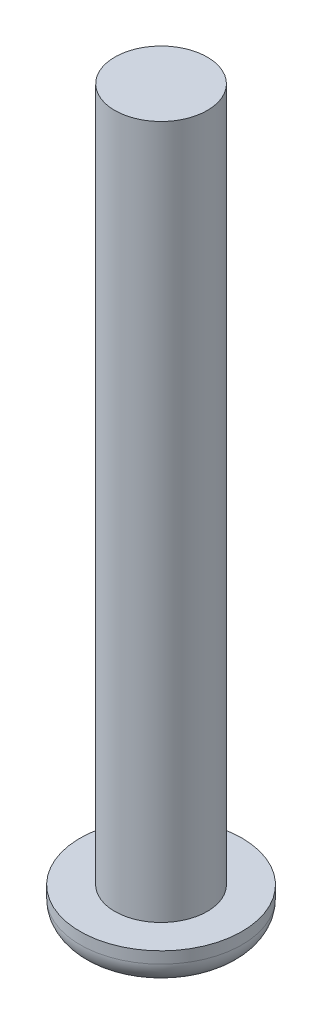
from build123d import *

# Parameters (mm, degrees)
SKETCH1_R           = 4
BOSS_EXTRUDE1_DEPTH = 60
SKETCH2_R           = 7
BOSS_EXTRUDE2_DEPTH = 3
FILLET1_R           = 2
CUT_EXTRUDE1_DEPTH  = 1
CUT_EXTRUDE1_DRAFT  = -15


with BuildPart() as part:
    # Sketch1 → Boss-Extrude1 (new body)
    with BuildSketch(Plane(origin=(0, 0, 0), x_dir=(1, 0, 0), z_dir=(0, 1, 0))):
        Circle(SKETCH1_R)
    extrude(amount=BOSS_EXTRUDE1_DEPTH)

    # Sketch2 → Boss-Extrude2 (add)
    with BuildSketch(Plane.XZ):
        Circle(SKETCH2_R)
    extrude(amount=BOSS_EXTRUDE2_DEPTH)

    # Fillet1
    fillet1_edges = [part.edges().sort_by_distance(p)[0] for p in [
        (-7, -3, 0),
    ]]
    fillet(fillet1_edges, radius=FILLET1_R)


with BuildPart() as cut_extrude1_tool:
    # Sketch3 → Cut-Extrude1 (with draft: the straight prism first)
    with BuildSketch(Plane.XZ.offset(3)):
        Polygon((0.375, 0.375), (0.375, 1.5), (-0.375, 1.5), (-0.375, 0.375), (-1.5, 0.375), (-1.5, -0.375), (-0.375, -0.375), (-0.375, -1.5), (0.375, -1.5), (0.375, -0.375), (1.5, -0.375), (1.5, 0.375), align=None)
    extrude(amount=-CUT_EXTRUDE1_DEPTH)
    # Cut-Extrude1: the draft: its side faces are tilted about the plane it starts from
    cut_extrude1_sides = [cut_extrude1_tool.faces().sort_by_distance(p)[0] for p in [
        (0.375, -2.5, 0.9375),
        (0, -2.5, 1.5),
        (-0.375, -2.5, 0.9375),
        (-0.9375, -2.5, 0.375),
        (-1.5, -2.5, 0),
        (-0.9375, -2.5, -0.375),
        (-0.375, -2.5, -0.9375),
        (0, -2.5, -1.5),
        (0.375, -2.5, -0.9375),
        (0.9375, -2.5, -0.375),
        (1.5, -2.5, 0),
        (0.9375, -2.5, 0.375),
    ]]
    draft(cut_extrude1_sides, Plane.XZ.offset(3), CUT_EXTRUDE1_DRAFT)


with BuildPart() as part_1:
    add(part.part)

    # Cut-Extrude1: cut by cut_extrude1_tool
    add(cut_extrude1_tool.part, mode=Mode.SUBTRACT)


solid = part_1.part
